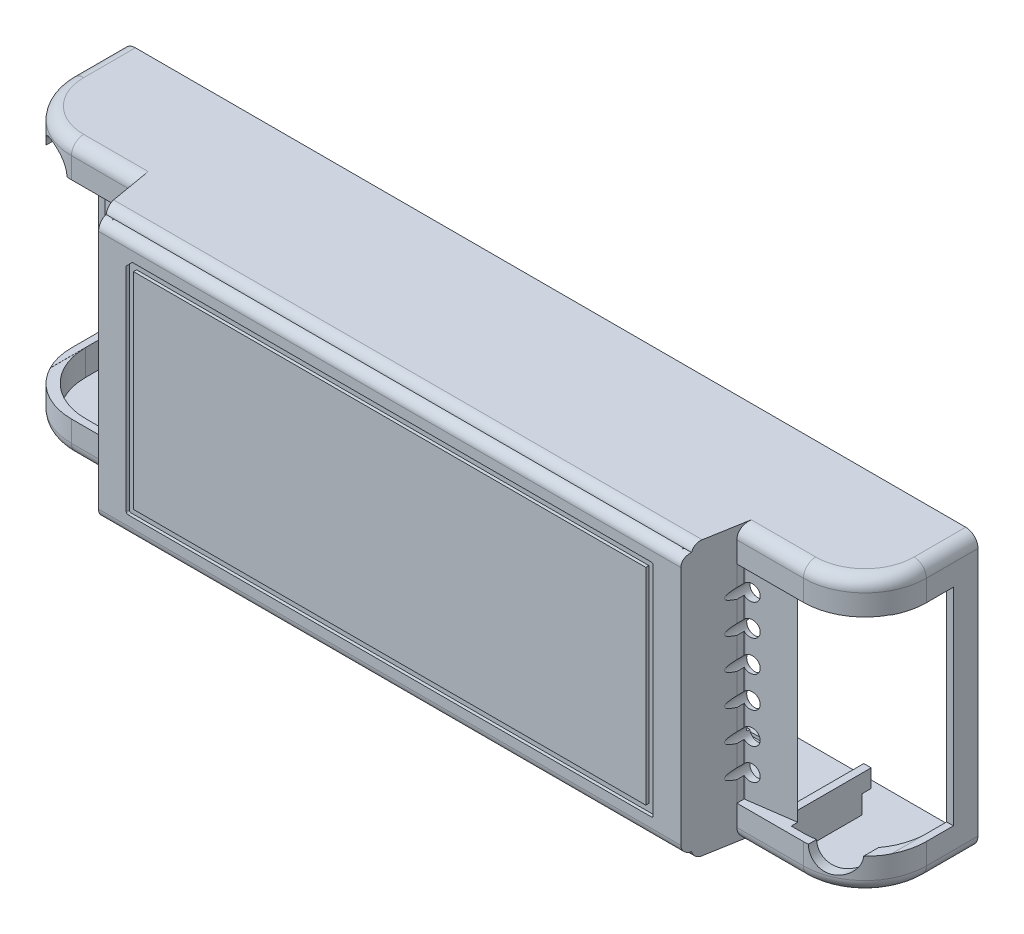
from build123d import *

# Parameters (mm, degrees)
SKETCH1_W                = 69.545
SKETCH1_H                = 44.53
BOSS_EXTRUDE1_DEPTH      = 26.17
SKETCH2_W                = 20.83
SKETCH2_H                = 44.53
CUT_EXTRUDE1_DEPTH       = 7.77
CUT_EXTRUDE2_DEPTH       = 63.264890237
SKETCH4_W                = 49.937118806
SKETCH4_H                = 33.7
CUT_EXTRUDE3_DEPTH       = 1.2
SKETCH5_W                = 12.08
SKETCH5_H                = 33.7
CUT_EXTRUDE4_DEPTH       = 46.204169954
SKETCH6_W                = 6.22
SKETCH6_H                = 33.63
CUT_EXTRUDE5_DEPTH       = 1.2
SKETCH8_W                = 8.18
SKETCH8_H                = 33.63
CUT_EXTRUDE6_DEPTH       = 1.2
SKETCH9_W                = 4.2
SKETCH9_H                = 33.7
CUT_EXTRUDE7_DEPTH       = 5
SKETCH11_W               = 11.8
SKETCH11_H               = 15.6
CUT_EXTRUDE8_DEPTH       = 5
CUT_EXTRUDE9_DEPTH       = 4.2
CUT_EXTRUDE10_DEPTH      = 4.2
SHELL3_START             = -21.065
SHELL3_DEPTH             = 42.13
SHELL3_2_OUTLINE_W       = 5
SHELL3_2_OUTLINE_H       = 10.6
SHELL3_2_DEPTH           = 12.08
SHELL3_START_2           = 9.015
SHELL3_3_OUTLINE_W       = 5
SHELL3_3_OUTLINE_H       = 10.6
SHELL3_3_DEPTH           = 12.05
SHELL3_4_DEPTH           = 3.03
SHELL3_START_3           = 18.065
SHELL3_5_DEPTH           = 3
SKETCH15_W               = 24.97
SKETCH15_H               = 42.13
CUT_EXTRUDE11_DEPTH      = 4.2
CUT_EXTRUDE12_DEPTH      = 4.2
SKETCH18_W               = 5
SKETCH18_H               = 12.05
CUT_EXTRUDE13_DEPTH      = 4.2
SKETCH19_W               = 46.355516444
SKETCH19_H               = 1.5
BOSS_EXTRUDE2_DEPTH      = 2.5
SKETCH22_W               = 49.678335722
SKETCH22_H               = 1.2
CUT_EXTRUDE16_DEPTH      = 1.5
SKETCH23_W               = 1.5
SKETCH23_H               = 1.2
CUT_EXTRUDE17_DEPTH      = 1.5
SKETCH24_W               = 47.365
SKETCH24_H               = 1.2
CUT_EXTRUDE18_DEPTH      = 1.5
SKETCH25_W               = 1.5
SKETCH25_H               = 1.2
CUT_EXTRUDE19_DEPTH      = 1.5
CUT_EXTRUDE20_DEPTH      = 0.5
FILLET1_R                = 1.5
FILLET5_R                = 10
FILLET6_R                = 10
FILLET7_R                = 2
SKETCH27_W               = 2.913383432
SKETCH27_H               = 1.2
CUT_EXTRUDE21_DEPTH      = 11.8
SKETCH28_W               = 2.69766396
SKETCH28_H               = 1.2
CUT_EXTRUDE22_DEPTH      = 11.8
SKETCH29_W               = 5.34766396
SKETCH29_H               = 15.645548361
CUT_EXTRUDE23_DEPTH      = 0.5
CUT_EXTRUDE24_DEPTH      = 108.935726486
CUT_EXTRUDE24_DEPTH_BACK = 108.935726486
SKETCH30_R               = 1.3
SKETCH31_W               = 5.563383432
SKETCH31_H               = 15.653597394
CUT_EXTRUDE25_DEPTH      = 0.5
SKETCH32_R               = 1.5
CUT_EXTRUDE26_DEPTH      = 108.935726486
CHAMFER2_SIZE            = 1
FILLET8_R                = 0.3
SKETCH33_R               = 3.09
CUT_EXTRUDE27_DEPTH      = 109.242464182
SKETCH34_R               = 3.09
CUT_EXTRUDE28_DEPTH      = 109.242464182
CHAMFER6_SIZE            = 7.5
CHAMFER6_SIZE_2          = 1.05405626
SKETCH35_W               = 6.5
SKETCH35_H               = 2
CUT_EXTRUDE29_DEPTH      = 0.5
CHAMFER7_SIZE            = 0.5
CHAMFER8_SIZE            = 0.5
SKETCH36_W               = 1.2
SKETCH36_H               = 2.99
SKETCH36_H_2             = 2.993179343
SKETCH36_H_3             = 3
CUT_EXTRUDE31_DEPTH      = 1.5
CUT_EXTRUDE32_REACH      = 132.514
SKETCH37_W               = 11.94594374
SKETCH37_H               = 30.793414359


# Read off the part's stored shape, not the designer's step: Shell3
# Some blends are built 0.0001 mm under size
with BuildPart() as part:
    # Sketch1 → Boss-Extrude1 (new body)
    with BuildSketch(Plane.XY):
        Rectangle(SKETCH1_W, SKETCH1_H)
    extrude(amount=BOSS_EXTRUDE1_DEPTH)

    # Sketch2 → Cut-Extrude1 (cut)
    with BuildSketch(Plane.XY.offset(26.17)):
        with Locations((24.3575, 0)):
            Rectangle(SKETCH2_W, SKETCH2_H)
    extrude(amount=-CUT_EXTRUDE1_DEPTH, mode=Mode.SUBTRACT)

    # Sketch3 → Cut-Extrude2 (cut, through all)
    with BuildSketch(Plane.XZ.offset(22.265)):
        Polygon((13.9425, 18.4), (13.9425, 26.17), (12.5925, 26.17), align=None)
    extrude(amount=-CUT_EXTRUDE2_DEPTH, mode=Mode.SUBTRACT)

    # Sketch4 → Cut-Extrude3 (cut)
    with BuildSketch(Plane.XY.offset(18.4)):
        with Locations((38.911059403, 0.015)):
            Rectangle(SKETCH4_W, SKETCH4_H)
    extrude(amount=-CUT_EXTRUDE3_DEPTH, mode=Mode.SUBTRACT)

    # Sketch5 → Cut-Extrude4 (cut, through all)
    with BuildSketch(Plane.XY.offset(18.4)):
        with Locations((27.6325, 0.015)):
            Rectangle(SKETCH5_W, SKETCH5_H)
    extrude(amount=-CUT_EXTRUDE4_DEPTH, mode=Mode.SUBTRACT)

    # Sketch6 → Cut-Extrude5 (cut)
    with BuildSketch(Plane(origin=(34.7725, 0, 0), x_dir=(0, 0, -1), z_dir=(1, 0, 0))):
        with Locations((-7.11, 0)):
            Rectangle(SKETCH6_W, SKETCH6_H)
    extrude(amount=-CUT_EXTRUDE5_DEPTH, mode=Mode.SUBTRACT)

    # Sketch8 → Cut-Extrude6 (cut)
    with BuildSketch(Plane(origin=(34.7725, 0, 0), x_dir=(0, 0, -1), z_dir=(1, 0, 0))):
        with Locations((-14.31, 0)):
            Rectangle(SKETCH8_W, SKETCH8_H)
    extrude(amount=-CUT_EXTRUDE6_DEPTH, mode=Mode.SUBTRACT)

    # Sketch9 → Cut-Extrude7 (cut)
    with BuildSketch(Plane(origin=(21.5925, 0, 0), x_dir=(0, 0, -1), z_dir=(1, 0, 0))):
        with Locations((-2.1, 0.015)):
            Rectangle(SKETCH9_W, SKETCH9_H)
    extrude(amount=-CUT_EXTRUDE7_DEPTH, mode=Mode.SUBTRACT)

    # Sketch11 → Cut-Extrude8 (cut)
    with BuildSketch(Plane(origin=(21.5925, 0, 0), x_dir=(0, 0, -1), z_dir=(1, 0, 0))):
        with Locations((-10.1, 0.015)):
            Rectangle(SKETCH11_W, SKETCH11_H)
    extrude(amount=-CUT_EXTRUDE8_DEPTH, mode=Mode.SUBTRACT)

    # Sketch13 → Cut-Extrude9 (cut)
    with BuildSketch(Plane.XZ.offset(-16.865)):
        Polygon((33.6725, 17.2), (21.5925, 17.2), (21.5925, 4.2), (16.5925, 4.2), (16.5925, 0), (33.6725, 0), align=None)
    extrude(amount=-CUT_EXTRUDE9_DEPTH, mode=Mode.SUBTRACT)

    # Sketch14 → Cut-Extrude10 (cut)
    with BuildSketch(Plane(origin=(0, -16.835, 0), x_dir=(1, 0, 0), z_dir=(0, 1, 0))):
        Polygon((33.6725, -17.2), (21.5925, -17.2), (21.5925, -4.2), (16.5925, -4.2), (16.5925, 0), (33.6725, 0), align=None)
    extrude(amount=-CUT_EXTRUDE10_DEPTH, mode=Mode.SUBTRACT)

    # Shell3 outline → Shell3 (cut)
    with BuildSketch(Plane(origin=(0, 0, 0), x_dir=(1, 0, 0), z_dir=(0, 1, 0)).offset(SHELL3_START)):
        Polygon((12.7425, -16), (15.3925, -16), (15.3925, 0), (-33.5725, 0), (-33.5725, -24.97), (11.583016444, -24.97), (12.7425, -18.296527977), align=None)
    extrude(amount=SHELL3_DEPTH, mode=Mode.SUBTRACT)

    # Shell3 2 outline → Shell3 2 (cut)
    with BuildSketch(Plane(origin=(0, 0, 0), x_dir=(1, 0, 0), z_dir=(0, 1, 0)).offset(SHELL3_START)):
        with Locations((17.8925, -10.7)):
            Rectangle(SHELL3_2_OUTLINE_W, SHELL3_2_OUTLINE_H)
    extrude(amount=SHELL3_2_DEPTH, mode=Mode.SUBTRACT)

    # Shell3 3 outline → Shell3 3 (cut)
    with BuildSketch(Plane(origin=(0, 0, 0), x_dir=(1, 0, 0), z_dir=(0, 1, 0)).offset(SHELL3_START_2)):
        with Locations((17.8925, -10.7)):
            Rectangle(SHELL3_3_OUTLINE_W, SHELL3_3_OUTLINE_H)
    extrude(amount=SHELL3_3_DEPTH, mode=Mode.SUBTRACT)

    # Shell3 4 outline → Shell3 4 (cut)
    with BuildSketch(Plane(origin=(0, 0, 0), x_dir=(1, 0, 0), z_dir=(0, 1, 0)).offset(SHELL3_START)):
        Polygon((20.3925, -17.2), (20.3925, -16), (12.7425, -16), (12.7425, -18.296527977), (12.933016444, -17.2), align=None)
    extrude(amount=SHELL3_4_DEPTH, mode=Mode.SUBTRACT)

    # Shell3 5 outline → Shell3 5 (cut)
    with BuildSketch(Plane(origin=(0, 0, 0), x_dir=(1, 0, 0), z_dir=(0, 1, 0)).offset(SHELL3_START_3)):
        Polygon((20.3925, -17.2), (20.3925, -16), (12.7425, -16), (12.7425, -18.296527977), (12.933016444, -17.2), align=None)
    extrude(amount=SHELL3_5_DEPTH, mode=Mode.SUBTRACT)

    # Sketch15 → Cut-Extrude11 (cut)
    with BuildSketch(Plane.ZY.offset(34.7725)):
        with Locations((12.485, 0)):
            Rectangle(SKETCH15_W, SKETCH15_H)
    extrude(amount=-CUT_EXTRUDE11_DEPTH, mode=Mode.SUBTRACT)

    # Sketch16 → Cut-Extrude12 (cut)
    with BuildSketch(Plane(origin=(16.5925, 0, 0), x_dir=(0, 0, -1), z_dir=(1, 0, 0))):
        Polygon((-16, -7.785), (-4.2, -7.785), (-4.2, -21.035), (0, -21.035), (0, 21.065), (-4.2, 21.065), (-4.2, 7.815), (-16, 7.815), align=None)
    extrude(amount=-CUT_EXTRUDE12_DEPTH, mode=Mode.SUBTRACT)

    # Sketch18 → Cut-Extrude13 (cut)
    with BuildSketch(Plane(origin=(0, 0, 4.2), x_dir=(-1, 0, 0), z_dir=(0, 0, -1))):
        with Locations((-17.8925, 15.04)):
            Rectangle(SKETCH18_W, SKETCH18_H)
        with Locations((-17.8925, -15.01)):
            Rectangle(SKETCH18_W, SKETCH18_H)
    extrude(amount=-CUT_EXTRUDE13_DEPTH, mode=Mode.SUBTRACT)

    # Sketch19 → Boss-Extrude2 (add)
    with BuildSketch(Plane(origin=(0, 0, 24.97), x_dir=(-1, 0, 0), z_dir=(0, 0, -1))):
        with Locations((11.594741778, -20.315)):
            Rectangle(SKETCH19_W, SKETCH19_H)
        with Locations((11.594741778, 20.315)):
            Rectangle(SKETCH19_W, SKETCH19_H)
    extrude(amount=BOSS_EXTRUDE2_DEPTH)

    # Sketch22 → Cut-Extrude16 (cut)
    with BuildSketch(Plane.XY.offset(26.17)):
        with Locations((-12.246667861, -21.665)):
            Rectangle(SKETCH22_W, SKETCH22_H)
    extrude(amount=-CUT_EXTRUDE16_DEPTH, mode=Mode.SUBTRACT)

    # Sketch23 → Cut-Extrude17 (cut)
    with BuildSketch(Plane.ZY.offset(-12.5925)):
        with Locations((25.42, -21.665)):
            Rectangle(SKETCH23_W, SKETCH23_H)
    extrude(amount=-CUT_EXTRUDE17_DEPTH, mode=Mode.SUBTRACT)

    # Sketch24 → Cut-Extrude18 (cut)
    with BuildSketch(Plane.XY.offset(26.17)):
        with Locations((-11.09, 21.665)):
            Rectangle(SKETCH24_W, SKETCH24_H)
    extrude(amount=-CUT_EXTRUDE18_DEPTH, mode=Mode.SUBTRACT)

    # Sketch25 → Cut-Extrude19 (cut)
    with BuildSketch(Plane.ZY.offset(-12.5925)):
        with Locations((25.42, 21.665)):
            Rectangle(SKETCH25_W, SKETCH25_H)
    extrude(amount=-CUT_EXTRUDE19_DEPTH, mode=Mode.SUBTRACT)

    # Sketch26 → Cut-Extrude20 (cut)
    with BuildSketch(Plane.XY.offset(26.17)):
        Polygon((8.0925, -17.955), (8.0925, 17.951908527), (-34.7725, 17.951908527), (-34.7725, 16.751908527), (6.8925, 16.751908527), (6.8925, -16.755), (-34.7725, -16.755), (-34.7725, -17.955), align=None)
    extrude(amount=-CUT_EXTRUDE20_DEPTH, mode=Mode.SUBTRACT)

    # Fillet1
    # the kernel refuses this fillet: 1.5 mm, written as the material it takes off along each edge
    with BuildSketch(Plane(origin=(16.3425, 21.065, 26.17), x_dir=(0, 0, -1), z_dir=(-1, 0, 0))) as fillet1_piece_1:
        with BuildLine():
            CenterArc((FILLET1_R, FILLET1_R), FILLET1_R, 180, 90)
            Line((0, FILLET1_R), (-FILLET1_R * 0.02, FILLET1_R))
            Line((-FILLET1_R * 0.02, FILLET1_R), (-FILLET1_R * 0.02, -FILLET1_R * 0.02))
            Line((-FILLET1_R * 0.02, -FILLET1_R * 0.02), (FILLET1_R, -FILLET1_R * 0.02))
            Line((FILLET1_R, -FILLET1_R * 0.02), (FILLET1_R, 0))
        make_face()
    extrude(amount=54.865, mode=Mode.SUBTRACT)
    with BuildSketch(Plane(origin=(-38.446734614, 22.265, 24.67), x_dir=(0, 0, -1), z_dir=(1, 0, 0)), Plane(origin=(16.527352375, -22.265, 24.67), x_dir=(0, 0, -1), z_dir=(-1, 0, 0))) as fillet1_piece_2:
        with BuildLine():
            CenterArc((1.469693846, -1.5), FILLET1_R, 90, 78.463040967)
            Line((0, -1.2), (-0.029393877, -1.194))
            ThreePointArc((-0.029393877, -1.194), (-0.03, -0.6), (-0.03, 0))
            Line((-0.03, 0), (0, 0.03))
            Line((0, 0.03), (1.469693846, 0.03))
            Line((1.469693846, 0.03), (1.469693846, 0))
        make_face()
    extrude(amount=54.974086989, mode=Mode.SUBTRACT)
    with BuildSketch(Plane(origin=(-38.5225, -21.065, 26.17), x_dir=(0, 1, 0), z_dir=(1, 0, 0))) as fillet1_piece_3:
        with BuildLine():
            CenterArc((FILLET1_R, -FILLET1_R), FILLET1_R, 90, 90)
            Line((0, -FILLET1_R), (-FILLET1_R * 0.02, -FILLET1_R))
            Line((-FILLET1_R * 0.02, -FILLET1_R), (-FILLET1_R * 0.02, FILLET1_R * 0.02))
            Line((-FILLET1_R * 0.02, FILLET1_R * 0.02), (FILLET1_R, FILLET1_R * 0.02))
            Line((FILLET1_R, FILLET1_R * 0.02), (FILLET1_R, 0))
        make_face()
    extrude(amount=54.865, mode=Mode.SUBTRACT)

    # Fillet5
    fillet5_edges = [part.edges().sort_by_distance(p)[0] for p in [
        (33.6725, 18.965, 17.2),
        (33.6725, -18.935, 17.2),
    ]]
    fillet(fillet5_edges, radius=FILLET5_R)

    # Fillet6
    # the kernel refuses this fillet: 10 mm, written as the material it takes off along each edge
    with BuildSketch(Plane(origin=(34.7725, -47.265, 18.4), x_dir=(0, 0, -1), z_dir=(0, 1, 0))) as fillet6_piece_1:
        with BuildLine():
            CenterArc((FILLET6_R, FILLET6_R), FILLET6_R, 180, 90)
            Line((0, FILLET6_R), (0, 0))
            Line((0, 0), (FILLET6_R, 0))
        make_face()
    extrude(amount=55.43, mode=Mode.SUBTRACT)
    with BuildSketch(Plane(origin=(34.7725, -8.135, 18.4), x_dir=(0, 0, -1), z_dir=(0, 1, 0))) as fillet6_piece_2:
        with BuildLine():
            CenterArc((FILLET6_R, FILLET6_R), FILLET6_R, 180, 90)
            Line((0, FILLET6_R), (0, 0))
            Line((0, 0), (FILLET6_R, 0))
        make_face()
    extrude(amount=55.4, mode=Mode.SUBTRACT)

    # Fillet7
    fillet7_edges = [part.edges().sort_by_distance(p)[0] for p in [
        (19.3575, -22.265, 18.4),
        (34.7725, -22.265, 4.2),
        (34.7725, 22.265, 4.2),
        (31.843567812, -22.265, 15.471067812),
        (19.3575, 22.265, 18.4),
        (31.843567812, 22.265, 15.471067812),
    ]]
    fillet(fillet7_edges, radius=FILLET7_R)

    # Mirror1: part across plane


with BuildPart() as part_1:
    add(part.part)
    add(part.part.mirror(Plane(origin=(-34.7725, 22.265, 26.17), x_dir=(0, 0, 1), z_dir=(1, 0, 0))))

    # Sketch27 → Cut-Extrude21 (cut)
    with BuildSketch(Plane(origin=(0, 0, 4.2), x_dir=(-1, 0, 0), z_dir=(0, 0, -1))):
        with Locations((86.394191716, 8.415)):
            Rectangle(SKETCH27_W, SKETCH27_H)
        with Locations((86.394191716, -8.385)):
            Rectangle(SKETCH27_W, SKETCH27_H)
    extrude(amount=-CUT_EXTRUDE21_DEPTH, mode=Mode.SUBTRACT)

    # Sketch28 → Cut-Extrude22 (cut)
    with BuildSketch(Plane(origin=(0, 0, 4.2), x_dir=(-1, 0, 0), z_dir=(0, 0, -1))):
        with Locations((-16.74133198, -8.385)):
            Rectangle(SKETCH28_W, SKETCH28_H)
        with Locations((-16.74133198, 8.415)):
            Rectangle(SKETCH28_W, SKETCH28_H)
    extrude(amount=-CUT_EXTRUDE22_DEPTH, mode=Mode.SUBTRACT)

    # Sketch29 → Cut-Extrude23 (cut)
    with BuildSketch(Plane(origin=(0, 0, 16), x_dir=(-1, 0, 0), z_dir=(0, 0, -1))):
        with Locations((-15.41633198, 0.037774181)):
            Rectangle(SKETCH29_W, SKETCH29_H)
    extrude(amount=-CUT_EXTRUDE23_DEPTH, mode=Mode.SUBTRACT)

    # Sketch30 → Cut-Extrude24 (cut, two sides: drawn at the far end of the back side and taken through both)
    with BuildSketch(Plane(origin=(0, 0, 16.5), x_dir=(-1, 0, 0), z_dir=(0, 0, -1)).offset(-CUT_EXTRUDE24_DEPTH_BACK)):
        with Locations(Location((-14.9425, -2.525, 0), (0, 0, 180))):
            Circle(SKETCH30_R)
        with Locations(Location((-14.9425, -12.685, 0), (0, 0, 180))):
            Circle(SKETCH30_R)
        with Locations(Location((-14.9425, -7.605, 0), (0, 0, 187.958831882))):
            Circle(SKETCH30_R)
        with Locations(Location((-14.9425, 7.635, 0), (0, 0, 170.008694141))):
            Circle(SKETCH30_R)
        with Locations(Location((-14.9425, 12.715, 0), (0, 0, 180))):
            Circle(SKETCH30_R)
        with Locations(Location((-14.9425, 2.555, 0), (0, 0, 180))):
            Circle(SKETCH30_R)
    extrude(amount=CUT_EXTRUDE24_DEPTH + CUT_EXTRUDE24_DEPTH_BACK, mode=Mode.SUBTRACT)

    # Sketch31 → Cut-Extrude25 (cut)
    with BuildSketch(Plane(origin=(0, 0, 16), x_dir=(-1, 0, 0), z_dir=(0, 0, -1))):
        with Locations((85.069191716, 0.041798697)):
            Rectangle(SKETCH31_W, SKETCH31_H)
    extrude(amount=-CUT_EXTRUDE25_DEPTH, mode=Mode.SUBTRACT)

    # Sketch32 → Cut-Extrude26 (cut, through all)
    with BuildSketch(Plane(origin=(0, 0, 16.5), x_dir=(-1, 0, 0), z_dir=(0, 0, -1))):
        with Locations((84.438711882, -5.411402598)):
            Circle(SKETCH32_R)
        with Locations((84.438326168, 4.748597394)):
            Circle(SKETCH32_R)
    extrude(amount=-CUT_EXTRUDE26_DEPTH, mode=Mode.SUBTRACT)

    # Chamfer2
    chamfer2_edges = [part_1.edges().sort_by_distance(p)[0] for p in [
        (-77.6375, 17.951908527, 25.92),
    ]]
    chamfer(chamfer2_edges, length=CHAMFER2_SIZE)

    # Fillet8
    fillet8_edges = [part_1.edges().sort_by_distance(p)[0] for p in [
        (8.0925, 17.951908527, 25.92),
        (8.0925, -17.955, 25.92),
        (-77.6375, -17.955, 25.92),
    ]]
    fillet(fillet8_edges, radius=FILLET8_R)

    # Sketch33 → Cut-Extrude27 (cut, through all)
    with BuildSketch(Plane.XY.offset(18.4)):
        with Locations((-98.1775, 16.865)):
            Circle(SKETCH33_R)
    extrude(amount=-CUT_EXTRUDE27_DEPTH, mode=Mode.SUBTRACT)

    # Sketch34 → Cut-Extrude28 (cut, through all)
    with BuildSketch(Plane.XY.offset(18.4)):
        with Locations((28.6325, -16.835)):
            Circle(SKETCH34_R)
    extrude(amount=-CUT_EXTRUDE28_DEPTH, mode=Mode.SUBTRACT)

    # Chamfer5
    # the kernel refuses this chamfer: 7.5, 1.05405626 mm, written as the material it takes off along each edge
    with BuildSketch(Plane(origin=(21.5925, 16.865, 17.2), x_dir=(-0.9999856632816031, 0, 0.005354739139527623), z_dir=(0, -1, 0))) as chamfer5_piece_1_section:
        with BuildLine():
            Line((7.797192207, 0), (-0.302943928, 1.094201692))
            Line((-0.302943928, 1.094201692), (-0.452941778, 1.093398481))
            ThreePointArc((-0.452941778, 1.093398481), (-0.152931733, 0.547093029), (-0.149997849, -0.000803211))
            Line((-0.149997849, -0.000803211), (0.000803211, -0.149997849))
            ThreePointArc((0.000803211, -0.149997849), (3.899287529, -0.129122184), (7.797995418, -0.149997849))
            Line((7.797995418, -0.149997849), (7.797192207, 0))
        make_face()
    chamfer5_piece_1 = extrude(amount=33.7, mode=Mode.PRIVATE)
    chamfer5_piece_1 = split(chamfer5_piece_1, bisect_by=Plane(origin=(19.225053222, 0.015, 17.2), z_dir=(0, 0, -1)), keep=Keep.TOP, mode=Mode.PRIVATE)
    add(chamfer5_piece_1, mode=Mode.SUBTRACT)

    # Chamfer6
    # the kernel refuses this chamfer: 7.5, 1.05405626 mm, written as the material it takes off along each edge
    with BuildSketch(Plane(origin=(-91.1375, 16.865, 17.2), x_dir=(0.9999856632816031, 0, 0.005354739139527627), z_dir=(0, -1, 0))) as chamfer6_piece_1:
        Polygon((CHAMFER6_SIZE * 0.999985663282, -CHAMFER6_SIZE * 0.00535473913953), (-CHAMFER6_SIZE_2 * 0.00535473914089, -CHAMFER6_SIZE_2 * 0.999985663536), (0, 0), align=None)
    extrude(amount=33.7, mode=Mode.SUBTRACT)

    # Sketch35 → Cut-Extrude29 (cut)
    with BuildSketch(Plane.XZ.offset(-21.065)):
        with Locations((1.9425, 4)):
            Rectangle(SKETCH35_W, SKETCH35_H)
        with Locations((-71.6075, 4)):
            Rectangle(SKETCH35_W, SKETCH35_H)
    cut_extrude29 = extrude(amount=-CUT_EXTRUDE29_DEPTH, mode=Mode.SUBTRACT)

    # Chamfer7
    chamfer7_edges = [part_1.edges().sort_by_distance(p)[0] for p in [
        (-71.6075, 21.065, 5),
        (1.9425, 21.065, 5),
    ]]
    chamfer(chamfer7_edges, length=CHAMFER7_SIZE - 0.0001)  # a hair under: the kernel refuses the full size

    # Mirror4: Cut-Extrude29 across plane
    add(cut_extrude29.mirror(Plane.ZX), mode=Mode.SUBTRACT)

    # Chamfer8
    chamfer8_edges = [part_1.edges().sort_by_distance(p)[0] for p in [
        (-71.6075, -21.065, 5),
        (1.9425, -21.065, 5),
    ]]
    chamfer(chamfer8_edges, length=CHAMFER8_SIZE - 0.0001)  # a hair under: the kernel refuses the full size

    # Sketch36 → Cut-Extrude31 (cut)
    with BuildSketch(Plane(origin=(0, 0, 4.2), x_dir=(-1, 0, 0), z_dir=(0, 0, -1))):
        with Locations((-20.9925, 19.57)):
            Rectangle(SKETCH36_W, SKETCH36_H)
        with Locations((-20.9925, -19.538410328)):
            Rectangle(SKETCH36_W, SKETCH36_H_2)
        with Locations((90.5375, 19.565)):
            Rectangle(SKETCH36_W, SKETCH36_H_3)
        with Locations((90.5375, -19.535)):
            Rectangle(SKETCH36_W, SKETCH36_H_3)
    extrude(amount=-CUT_EXTRUDE31_DEPTH, mode=Mode.SUBTRACT)

    # Cut-Extrude32: up to this face of the body (flat: up to its plane)
    cut_extrude32_end = Plane(part_1.part.faces().sort_by_distance((18.09016396, -8.385, 10.1))[0])
    # Sketch37 → Cut-Extrude32 (cut, up to the picked face)
    with BuildSketch(Plane(origin=(21.5925, 0, 0), x_dir=(0, 0, -1), z_dir=(1, 0, 0)), mode=Mode.PRIVATE) as cut_extrude32_sk1:
        with Locations((-10.17297187, 0.268292821)):
            Rectangle(SKETCH37_W, SKETCH37_H)
    cut_extrude32_tool1 = split(extrude(cut_extrude32_sk1.sketch, amount=-CUT_EXTRUDE32_REACH, mode=Mode.PRIVATE), bisect_by=cut_extrude32_end, keep=Keep.BOTH, mode=Mode.PRIVATE)
    add(cut_extrude32_tool1.solids().sort_by(Axis((21.5925, 0.268293, 10.172972), (-1, 0, 0)))[0], mode=Mode.SUBTRACT)


solid = part_1.part
